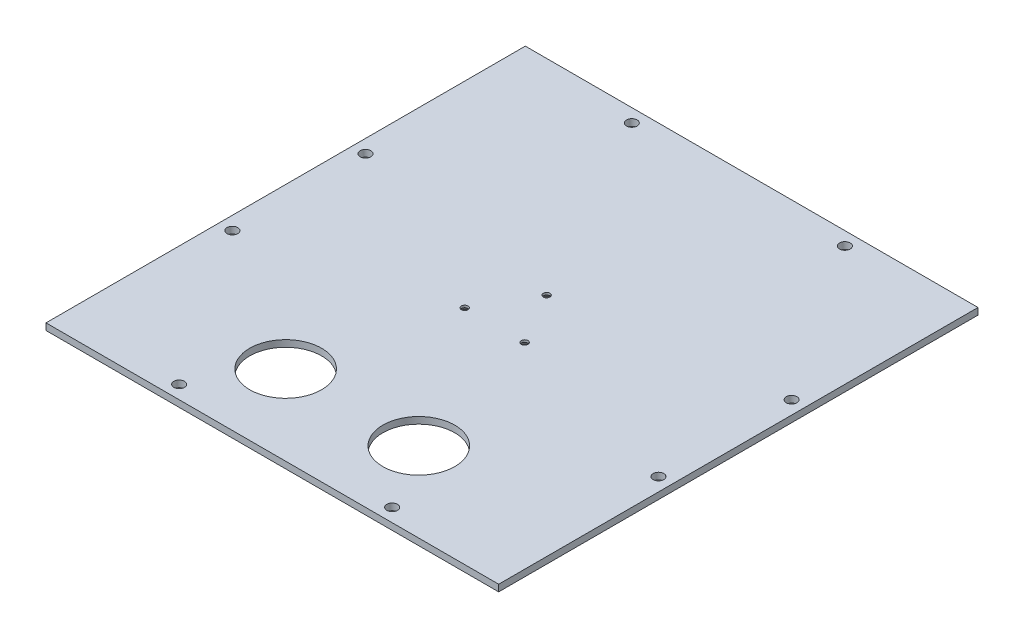
from build123d import *
from OCP.BRepFilletAPI import BRepFilletAPI_MakeChamfer

# Parameters (mm, degrees)
SKETCH1_W           = 215.9
SKETCH1_H           = 228.6
BOSS_EXTRUDE1_DEPTH = 3.175
SKETCH2_R           = 17.145
CUT_EXTRUDE1_DEPTH  = 315.453256661
SKETCH3_R           = 1.5875
CUT_EXTRUDE2_DEPTH  = 315.453256661
SKETCH4_R           = 2.54
CUT_EXTRUDE3_DEPTH  = 315.453256661
CHAMFER1_SIZE       = 2.1082
CHAMFER1_SIZE2      = 1.832630301
SKETCH5_W           = 76.2
SKETCH5_H           = 88.9
CUT_EXTRUDE4_DEPTH  = 1.5875
FILLET1_R           = 3.175
FILLET2_R           = 25.4


with BuildPart() as part:
    # Sketch1 → Boss-Extrude1 (new body)
    with BuildSketch(Plane(origin=(0, 0, 0), x_dir=(1, 0, 0), z_dir=(0, 1, 0))):
        with Locations((107.95, 114.3)):
            Rectangle(SKETCH1_W, SKETCH1_H)
    extrude(amount=BOSS_EXTRUDE1_DEPTH)

    # Sketch2 → Cut-Extrude1 (cut, through all)
    with BuildSketch(Plane(origin=(0, 3.175, 0), x_dir=(1, 0, 0), z_dir=(0, 1, 0))):
        with Locations((139.7, 38.1)):
            Circle(SKETCH2_R)
        with Locations((76.2, 38.1)):
            Circle(SKETCH2_R)
    extrude(amount=-CUT_EXTRUDE1_DEPTH, mode=Mode.SUBTRACT)

    # Sketch3 → Cut-Extrude2 (cut, through all)
    with BuildSketch(Plane(origin=(0, 3.175, 0), x_dir=(1, 0, 0), z_dir=(0, 1, 0))):
        with Locations((107.95, 130.81)):
            Circle(SKETCH3_R)
        with Locations((122.248079416, 106.045)):
            Circle(SKETCH3_R)
        with Locations((93.651920584, 106.045)):
            Circle(SKETCH3_R)
    extrude(amount=-CUT_EXTRUDE2_DEPTH, mode=Mode.SUBTRACT)

    # Sketch4 → Cut-Extrude3 (cut, through all)
    with BuildSketch(Plane(origin=(0, 3.175, 0), x_dir=(1, 0, 0), z_dir=(0, 1, 0))):
        with Locations((6.35, 146.05)):
            Circle(SKETCH4_R)
        with Locations((6.35, 82.55)):
            Circle(SKETCH4_R)
        with Locations((57.15, 6.35)):
            Circle(SKETCH4_R)
        with Locations((57.15, 222.25)):
            Circle(SKETCH4_R)
        with Locations((158.75, 6.35)):
            Circle(SKETCH4_R)
        with Locations((209.55, 82.55)):
            Circle(SKETCH4_R)
        with Locations((209.55, 146.05)):
            Circle(SKETCH4_R)
        with Locations((158.75, 222.25)):
            Circle(SKETCH4_R)
    extrude(amount=-CUT_EXTRUDE3_DEPTH, mode=Mode.SUBTRACT)

    # Chamfer1: one chamfer whose edges measure the first distance from different faces: ONE call of the kernel's chamfer builder (chamfer() names one face for all edges)
    chamfer1_edges_1 = [part.edges().sort_by_distance(p)[0] for p in [
        (92.064420584, 0, -106.045),
    ]]
    chamfer1_side_1 = [part.faces().sort_by_distance(p)[0] for p in [
        (92.064420584, 1.5875, -106.045),
    ]]
    chamfer1_edges_2 = [part.edges().sort_by_distance(p)[0] for p in [
        (120.660579416, 0, -106.045),
    ]]
    chamfer1_side_2 = [part.faces().sort_by_distance(p)[0] for p in [
        (120.660579416, 1.5875, -106.045),
    ]]
    chamfer1_edges_3 = [part.edges().sort_by_distance(p)[0] for p in [
        (106.3625, 0, -130.81),
    ]]
    chamfer1_side_3 = [part.faces().sort_by_distance(p)[0] for p in [
        (106.3625, 1.5875, -130.81),
    ]]
    chamfer1 = BRepFilletAPI_MakeChamfer(part.part.solid().wrapped)
    for e in chamfer1_edges_1:
        chamfer1.Add(CHAMFER1_SIZE, CHAMFER1_SIZE2, e.wrapped, chamfer1_side_1[0].wrapped)  # the first distance lies on this face
    for e in chamfer1_edges_2:
        chamfer1.Add(CHAMFER1_SIZE, CHAMFER1_SIZE2, e.wrapped, chamfer1_side_2[0].wrapped)  # the first distance lies on this face
    for e in chamfer1_edges_3:
        chamfer1.Add(CHAMFER1_SIZE, CHAMFER1_SIZE2, e.wrapped, chamfer1_side_3[0].wrapped)  # the first distance lies on this face
    add(Compound.cast(chamfer1.Shape()), mode=Mode.REPLACE)

    # Sketch5 → Cut-Extrude4 (cut)
    with BuildSketch(Plane.XZ):
        with Locations((57.15, -165.1)):
            Rectangle(SKETCH5_W, SKETCH5_H)
        Polygon((19.05, -95.25), (95.25, -95.25), (95.25, -69.85), (44.45, -69.85), (44.45, -19.05), (19.05, -19.05), align=None)
        with Locations((158.75, -165.1)):
            Rectangle(SKETCH5_W, SKETCH5_H)
        Polygon((196.85, -95.25), (196.85, -19.05), (171.45, -19.05), (171.45, -69.85), (120.65, -69.85), (120.65, -95.25), align=None)
    extrude(amount=-CUT_EXTRUDE4_DEPTH, mode=Mode.SUBTRACT)

    # Fillet1
    fillet1_edges = [part.edges().sort_by_distance(p)[0] for p in [
        (19.05, 0.79375, -95.25),
        (95.25, 0.79375, -95.25),
        (95.25, 0.79375, -69.85),
        (44.45, 0.79375, -19.05),
        (19.05, 0.79375, -19.05),
        (196.85, 0.79375, -19.05),
        (196.85, 0.79375, -95.25),
        (171.45, 0.79375, -19.05),
        (120.65, 0.79375, -69.85),
        (120.65, 0.79375, -95.25),
        (196.85, 0.79375, -120.65),
        (120.65, 0.79375, -120.65),
        (120.65, 0.79375, -209.55),
        (196.85, 0.79375, -209.55),
        (95.25, 0.79375, -209.55),
        (95.25, 0.79375, -120.65),
        (19.05, 0.79375, -209.55),
        (19.05, 0.79375, -120.65),
    ]]
    fillet(fillet1_edges, radius=FILLET1_R)

    # Fillet2
    fillet2_edges = [part.edges().sort_by_distance(p)[0] for p in [
        (171.45, 0.79375, -69.85),
        (44.45, 0.79375, -69.85),
    ]]
    fillet(fillet2_edges, radius=FILLET2_R)


solid = part.part
